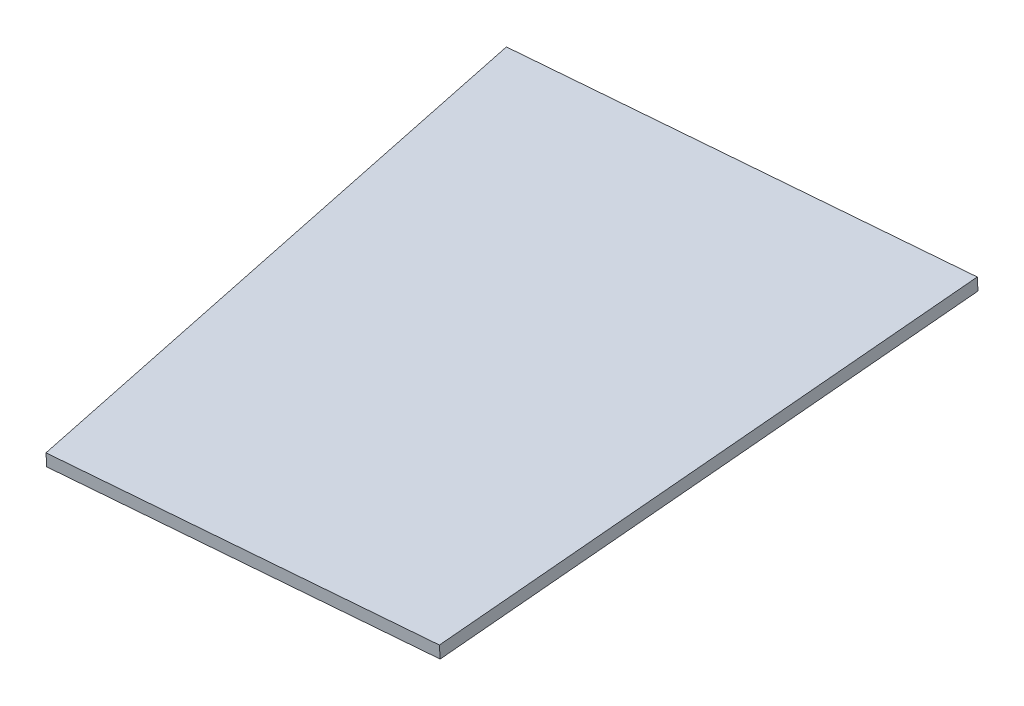
from build123d import *

# Parameters (mm, degrees)
BOSS_EXTRUDE1_DEPTH = 12.7


with BuildPart() as part:
    # PedalBox Floor → Boss-Extrude1 (new body)
    with BuildSketch(Plane(origin=(2.27931119, 231.128646883, 15.811184669), x_dir=(-0.9999514494352708, 0.00985317692945217, 0.00011694741562377394), z_dir=(-0.009838185478505344, -0.997620029759067, -0.06824577884388791))):
        Polygon((822.561061512, -1122.255218481), (810.172867757, -1673.144078058), (1171.725667, -1704.809693927), (1255.287719846, -1160.154402688), align=None)
    extrude(amount=BOSS_EXTRUDE1_DEPTH)


solid = part.part
